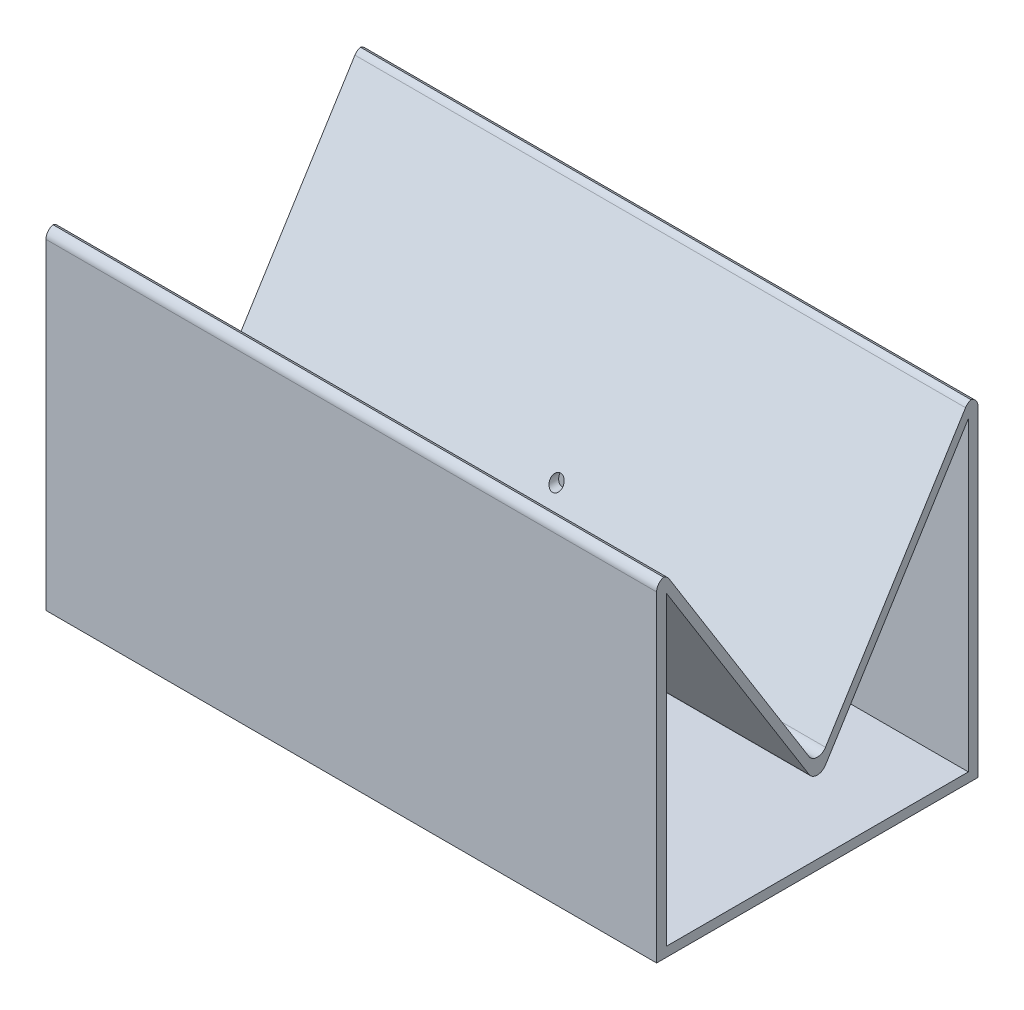
from build123d import *

# Parameters (mm, degrees)
SKETCH1_W                = 190
SKETCH1_H                = 100
BOSS_EXTRUDE1_DEPTH      = 3
BOSS_EXTRUDE2_DEPTH      = 95
BOSS_EXTRUDE2_DEPTH_BACK = 95
SKETCH2_W                = 3
SKETCH2_H                = 100
FILLET1_R                = 3
CUT_EXTRUDE1_DEPTH       = 30
CUT_EXTRUDE1_DEPTH_BACK  = 30
SKETCH3_R                = 2


with BuildPart() as part:
    # Sketch1 → Boss-Extrude1 (new body)
    with BuildSketch(Plane(origin=(0, 0, 0), x_dir=(1, 0, 0), z_dir=(0, 1, 0))):
        Rectangle(SKETCH1_W, SKETCH1_H)
    extrude(amount=BOSS_EXTRUDE1_DEPTH)

    # Sketch2 → Boss-Extrude2 (add, two sides: drawn at the far end of the back side and taken through both)
    with BuildSketch(Plane(origin=(0, 0, 0), x_dir=(0, 0, -1), z_dir=(1, 0, 0)).offset(-BOSS_EXTRUDE2_DEPTH_BACK)):
        with Locations((-48.5, 53)):
            Rectangle(SKETCH2_W, SKETCH2_H)
        Polygon((0, 23), (0, 27.8), (-47, 103), (-47, 98.2), align=None)
        Polygon((47, 98.2), (47, 103), (0, 27.8), (0, 23), align=None)
        with Locations((48.5, 53)):
            Rectangle(SKETCH2_W, SKETCH2_H)
    extrude(amount=BOSS_EXTRUDE2_DEPTH + BOSS_EXTRUDE2_DEPTH_BACK)

    # Fillet1
    # the kernel refuses this fillet: 3 mm, written as the material it adds along each edge
    with BuildSketch(Plane(origin=(-95, 27.8, 0), x_dir=(0, 0.8479983040050875, -0.529998940003181), z_dir=(1, 0, 0))) as fillet1_piece_1:
        with BuildLine():
            CenterArc((FILLET1_R * 1.6, FILLET1_R), FILLET1_R, 154.010766416, 115.989233584)
            Line((FILLET1_R * 0.701123595506, FILLET1_R * 1.43820224719), (0, 0))
            Line((0, 0), (FILLET1_R * 1.6, 0))
        make_face()
    extrude(amount=190)
    # the kernel refuses this fillet: 3 mm, written as the material it takes off along each edge
    with BuildSketch(Plane(origin=(-107, 23, 0), x_dir=(0, 0.8479983040050876, 0.5299989400031808), z_dir=(1, 0, 0))) as fillet1_2_piece_1:
        with BuildLine():
            CenterArc((FILLET1_R * 1.6, -FILLET1_R), FILLET1_R, 90, 115.989233584)
            Line((FILLET1_R * 0.701123595506, -FILLET1_R * 1.43820224719), (0, 0))
            Line((0, 0), (FILLET1_R * 1.6, 0))
        make_face()
    extrude(amount=214, mode=Mode.SUBTRACT)
    with BuildSketch(Plane(origin=(102.5, 103, 50), x_dir=(0, -1, 0), z_dir=(-1, 0, 0)), Plane(origin=(-102.5, 103, -50), x_dir=(0, -1, 0), z_dir=(1, 0, 0))) as fillet1_2_piece_2:
        with BuildLine():
            CenterArc((FILLET1_R, -FILLET1_R), FILLET1_R, 90, 90)
            Line((0, -FILLET1_R), (0, 0))
            Line((0, 0), (FILLET1_R, 0))
        make_face()
    extrude(amount=205, mode=Mode.SUBTRACT)
    with BuildSketch(Plane(origin=(99.156857311, 103, 47), x_dir=(0, 0, 1), z_dir=(-1, 0, 0)), Plane(origin=(-99.156857311, 103, -47), x_dir=(0, 0, -1), z_dir=(1, 0, 0))) as fillet1_2_piece_3:
        with BuildLine():
            CenterArc((FILLET1_R * 0.554247641507, -FILLET1_R), FILLET1_R, 90, 57.994616792)
            Line((-FILLET1_R * 0.293750662498, -FILLET1_R * 0.470001059997), (0, 0))
            Line((0, 0), (FILLET1_R * 0.554247641507, 0))
        make_face()
    extrude(amount=198.313714623, mode=Mode.SUBTRACT)

    # Sketch3 → Cut-Extrude1 (cut, two sides: drawn at the far end of the back side and taken through both)
    with BuildSketch(Plane.XY.offset(-CUT_EXTRUDE1_DEPTH_BACK)):
        with Locations(Location((0, 50, 0), (0, 0, 270))):
            Circle(SKETCH3_R)
    extrude(amount=CUT_EXTRUDE1_DEPTH + CUT_EXTRUDE1_DEPTH_BACK, mode=Mode.SUBTRACT)


solid = part.part
